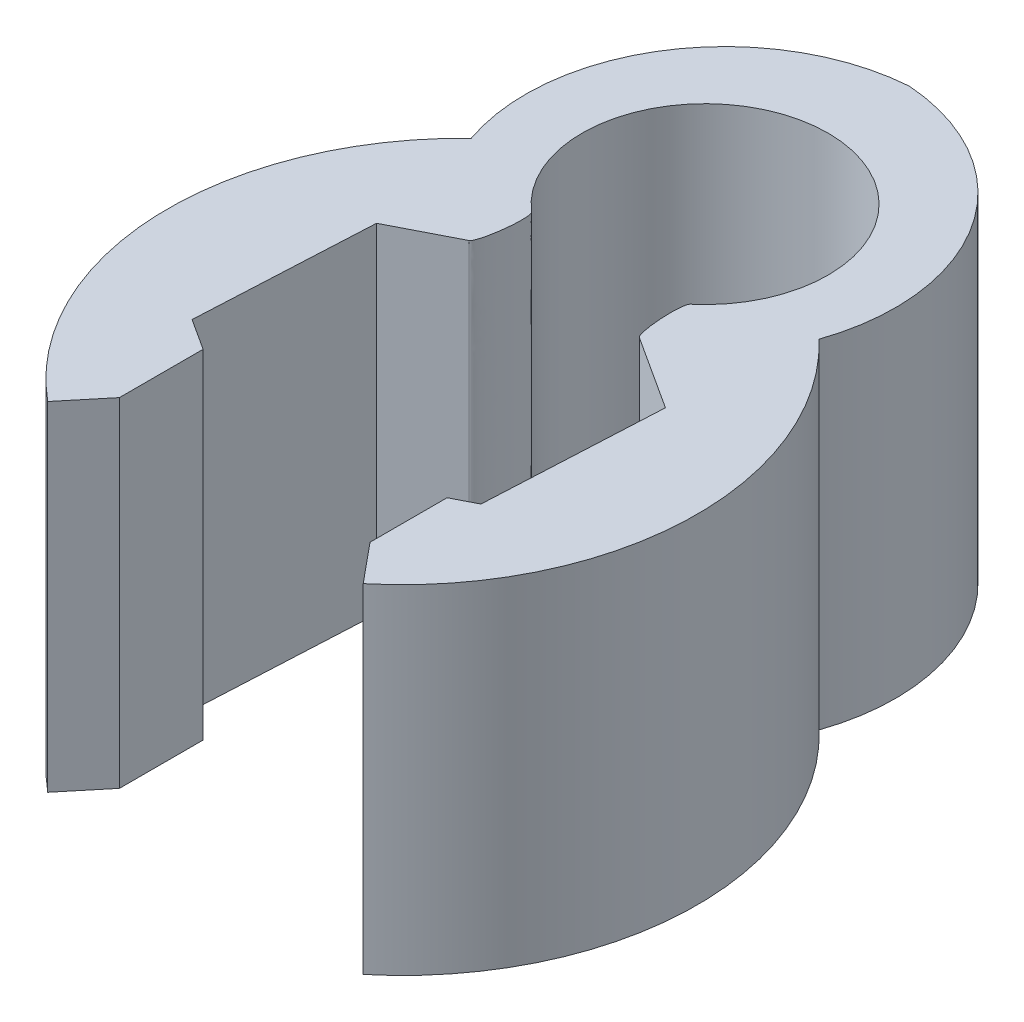
from build123d import *

# Parameters (mm, degrees)
BOSS_EXTRUDE1_DEPTH = 12.7


with BuildPart() as part:
    # Sketch3 → Boss-Extrude1 (new body)
    with BuildSketch(Plane(origin=(0, 0, 0), x_dir=(1, 0, 0), z_dir=(0, 1, 0))):
        with BuildLine():
            Line((-5.541525375, 3.58326618), (-2.47962532, 5.150959008))
            Line((-2.47962532, 5.150959008), (-2.47962532, 6.474170352))
            ThreePointArc((-2.47962532, 6.474170352), (-2.221563685, 14.417025562), (4.617359972, 10.369227654))
            ThreePointArc((4.617359972, 10.369227654), (4.047797908, 8.147663968), (2.47962532, 6.474170352))
            Line((2.47962532, 6.474170352), (2.47962532, 5.20231788))
            Line((2.47962532, 5.20231788), (5.873962228, 3.007468661))
            Line((5.873962228, 3.007468661), (5.541525375, -3.58326618))
            Line((5.541525375, -3.58326618), (4.701204968, -4.013510228))
            Line((4.701204968, -4.013510228), (4.701204968, -6.905610932))
            Line((4.701204968, -6.905610932), (5.918780254, -8.378526195))
            ThreePointArc((5.918780254, -8.378526195), (9.922634137, -0.265088751), (6.526624698, 8.120961152))
            ThreePointArc((6.526624698, 8.120961152), (5.706991897, 14.686716316), (0, 18.035026682))
            ThreePointArc((0, 18.035026682), (-5.706991897, 14.686716316), (-6.526624698, 8.120961152))
            ThreePointArc((-6.526624698, 8.120961152), (-9.922634137, -0.265088751), (-5.918780254, -8.378526195))
            Line((-5.918780254, -8.378526195), (-4.701204968, -6.905610932))
            Line((-4.701204968, -6.905610932), (-4.701204968, -3.765798027))
            Line((-4.701204968, -3.765798027), (-5.873962228, -3.007468661))
            Line((-5.873962228, -3.007468661), (-5.541525375, 3.58326618))
        make_face()
        with BuildLine():
            Line((-2.47962532, 6.474170352), (-2.47962532, 5.150959008))
            Line((-2.47962532, 5.150959008), (-1.063503338, 5.876013463))
            ThreePointArc((-1.063503338, 5.876013463), (-1.79663243, 6.115743784), (-2.47962532, 6.474170352))
        make_face()
        with BuildLine():
            ThreePointArc((2.47962532, 6.474170352), (1.921985685, 6.17089654), (1.328021538, 5.946968965))
            Line((1.328021538, 5.946968965), (2.47962532, 5.20231788))
            Line((2.47962532, 5.20231788), (2.47962532, 6.474170352))
        make_face()
    extrude(amount=BOSS_EXTRUDE1_DEPTH)

    # Fillet6
    # a fillet whose section is not a circle: 1.27 mm, written as the material it takes off along each edge
    with BuildSketch(Plane(origin=(1.328021538, -5.283304691, -5.946968965), x_dir=(0.8397378391322112, 0, 0.5429920455490709), z_dir=(0, 1, 0))) as fillet6_piece_1:
        with BuildLine():
            Bezier((2.113321876, 0), (0.3966534, 0), (0.898889741, 1.641556979), weights=[1, 0.118948346, 1])
            ThreePointArc((0.898889741, 1.641556979), (0.533488386, 0.774757636), (0, 0))
            Line((0, 0), (2.113321876, 0))
        make_face()
    extrude(amount=23.266609382, mode=Mode.SUBTRACT)
    with BuildSketch(Plane(origin=(-1.063503338, -6.120582224, -5.876013463), x_dir=(-0.891835980226881, 0, -0.4523589110128793), z_dir=(0, 1, 0))) as fillet6_piece_2:
        with BuildLine():
            Bezier((2.168149873, 0), (0.323600022, 0.445521101), (1.438773255, 1.980852292), weights=[1, 0.11123936, 1])
            Line((1.438773255, 1.980852292), (0, 0))
            ThreePointArc((0, 0), (1.084074937, 0.129064678), (2.168149873, 0))
        make_face()
    extrude(amount=24.941164449, mode=Mode.SUBTRACT)


solid = part.part
